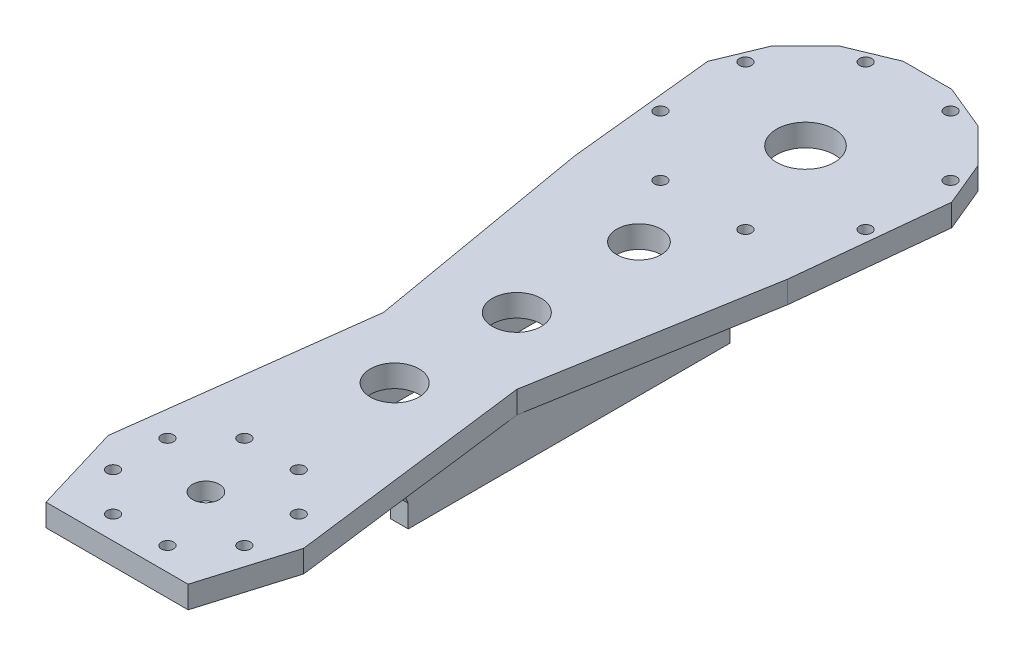
from build123d import *

# Parameters (mm, degrees)
SK_THIGH_PLATE_R         = 2.75
SK_THIGH_PLATE_R_2       = 6
SK_THIGH_PLATE_R_3       = 13
SK_THIGH_PLATE_R_4       = 11
SK_THIGH_PLATE_R_5       = 10
THIGH_PLATE_DEPTH        = 10
SK_PITCH_PILOT_RECESS_R  = 25.15
PITCH_PILOT_RECESS_DEPTH = 2.2
FRONT_FLANGE_DEPTH       = 8
BACK_FLANGE_DEPTH        = 8


with BuildPart() as part:
    # SK_Thigh_Plate → Thigh_Plate (new body)
    with BuildSketch(Plane(origin=(0, 36, 0), x_dir=(1, 0, 0), z_dir=(0, 1, 0))):
        Polygon((-32, -40), (32, -40), (44, 0), (30, 110), (48, 214), (54.923975703, 280.925058033), (46.562298289, 301.111933049), (31.111933049, 316.562298289), (10.925058033, 324.923975703), (-10.925058033, 324.923975703), (-31.111933049, 316.562298289), (-46.562298289, 301.111933049), (-54.923975703, 280.925058033), (-48, 214), (-30, 110), (-44, 0), align=None)
        with Locations((29.56414504, 12.245869836)):
            Circle(SK_THIGH_PLATE_R, mode=Mode.SUBTRACT)
        with Locations((12.245869836, 29.56414504)):
            Circle(SK_THIGH_PLATE_R, mode=Mode.SUBTRACT)
        with Locations((-12.245869836, 29.56414504)):
            Circle(SK_THIGH_PLATE_R, mode=Mode.SUBTRACT)
        with Locations((-29.56414504, 12.245869836)):
            Circle(SK_THIGH_PLATE_R, mode=Mode.SUBTRACT)
        with Locations((-29.56414504, -12.245869836)):
            Circle(SK_THIGH_PLATE_R, mode=Mode.SUBTRACT)
        with Locations((-12.245869836, -29.56414504)):
            Circle(SK_THIGH_PLATE_R, mode=Mode.SUBTRACT)
        with Locations((12.245869836, -29.56414504)):
            Circle(SK_THIGH_PLATE_R, mode=Mode.SUBTRACT)
        with Locations((29.56414504, -12.245869836)):
            Circle(SK_THIGH_PLATE_R, mode=Mode.SUBTRACT)
        with Locations((46.193976626, 289.134171618)):
            Circle(SK_THIGH_PLATE_R, mode=Mode.SUBTRACT)
        with Locations((19.134171618, 316.193976626)):
            Circle(SK_THIGH_PLATE_R, mode=Mode.SUBTRACT)
        with Locations((-19.134171618, 316.193976626)):
            Circle(SK_THIGH_PLATE_R, mode=Mode.SUBTRACT)
        with Locations((-46.193976626, 289.134171618)):
            Circle(SK_THIGH_PLATE_R, mode=Mode.SUBTRACT)
        with Locations((-46.193976626, 250.865828382)):
            Circle(SK_THIGH_PLATE_R, mode=Mode.SUBTRACT)
        with Locations((-19.134171618, 223.806023374)):
            Circle(SK_THIGH_PLATE_R, mode=Mode.SUBTRACT)
        with Locations((19.134171618, 223.806023374)):
            Circle(SK_THIGH_PLATE_R, mode=Mode.SUBTRACT)
        with Locations((46.193976626, 250.865828382)):
            Circle(SK_THIGH_PLATE_R, mode=Mode.SUBTRACT)
        Circle(SK_THIGH_PLATE_R_2, mode=Mode.SUBTRACT)
        with Locations((0, 270)):
            Circle(SK_THIGH_PLATE_R_3, mode=Mode.SUBTRACT)
        with Locations((0, 85)):
            Circle(SK_THIGH_PLATE_R_4, mode=Mode.SUBTRACT)
        with Locations((0, 140)):
            Circle(SK_THIGH_PLATE_R_4, mode=Mode.SUBTRACT)
        with Locations((0, 195)):
            Circle(SK_THIGH_PLATE_R_5, mode=Mode.SUBTRACT)
    extrude(amount=THIGH_PLATE_DEPTH)

    # SK_Pitch_Pilot_Recess → Pitch_Pilot_Recess (cut)
    with BuildSketch(Plane(origin=(0, 36, 0), x_dir=(1, 0, 0), z_dir=(0, 1, 0))):
        Circle(SK_PITCH_PILOT_RECESS_R)
    extrude(amount=PITCH_PILOT_RECESS_DEPTH, mode=Mode.SUBTRACT)

    # SK_Front_Flange → Front_Flange (add)
    with BuildSketch(Plane(origin=(22, 0, 0), x_dir=(0, 0, -1), z_dir=(1, 0, 0))):
        Polygon((35.597687784, 31), (35.597687784, 36), (206, 36), (206, 16), (61.099916805, 16), (61.099916805, 26), (59.099916805, 31), align=None)
    extrude(amount=FRONT_FLANGE_DEPTH)

    # SK_Back_Flange → Back_Flange (add)
    with BuildSketch(Plane(origin=(-30, 0, 0), x_dir=(0, 0, -1), z_dir=(1, 0, 0))):
        Polygon((35.597687784, 31), (35.597687784, 36), (206, 36), (206, 16), (61.099916805, 16), (61.099916805, 26), (59.099916805, 31), align=None)
    extrude(amount=BACK_FLANGE_DEPTH)


solid = part.part
